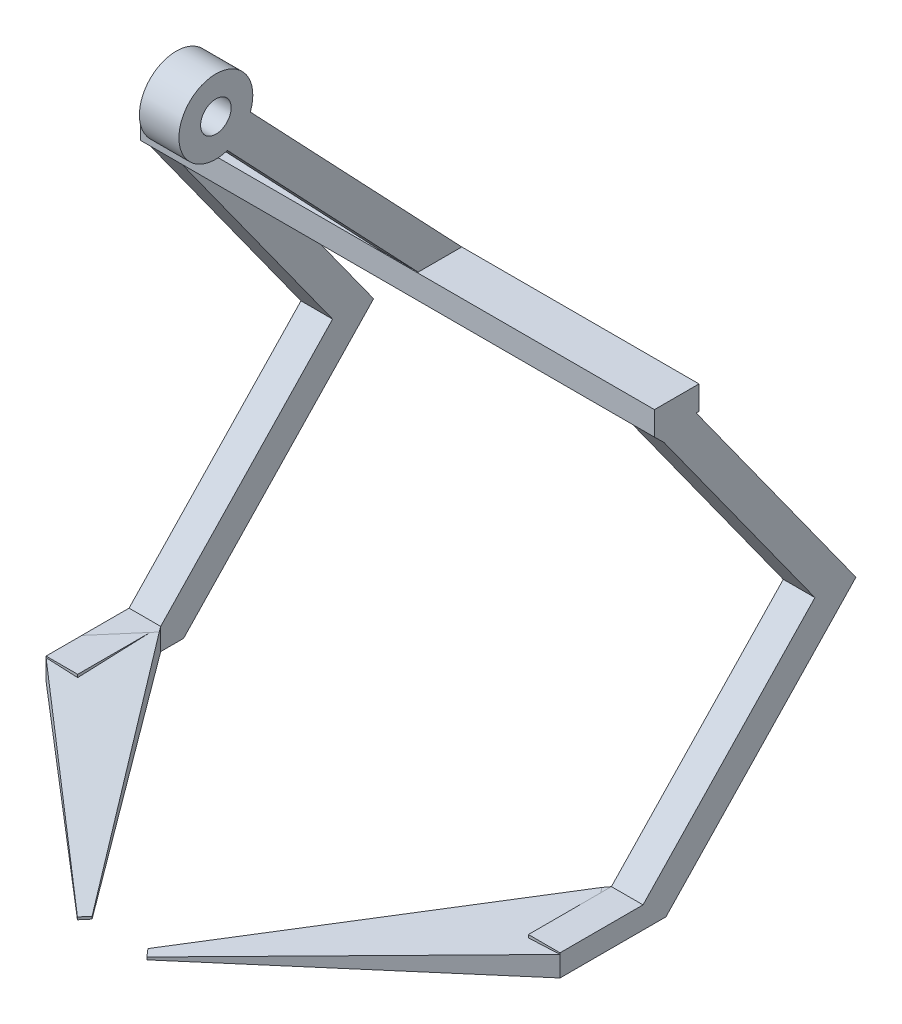
from build123d import *

# Parameters (mm, degrees)
SKETCH1_R                = 1.933011648
BOSS_EXTRUDE2_DEPTH      = 5
BOSS_EXTRUDE3_DEPTH      = 30
BOSS_EXTRUDE3_DEPTH_BACK = 35
SKETCH2_W                = 5.631130668
SKETCH2_H                = 3.014930961
BOSS_EXTRUDE4_DEPTH      = 4
LPATTERN1_COUNT          = 2
LPATTERN1_PITCH          = 61
BOSS_EXTRUDE7_START      = -2.761388983
BOSS_EXTRUDE7_DEPTH      = 2.761388983
CHAMFER4_SIZE            = 2.446504806
CHAMFER4_SIZE_2          = 40
CHAMFER5_SIZE            = 2.446504806
CHAMFER5_SIZE_2          = 40


# Read off the part's stored shape, not the designer's step: Boss-Extrude7
with BuildPart() as part:
    # Sketch1 → Boss-Extrude2 (new body)
    with BuildSketch(Plane(origin=(0, 0, 0), x_dir=(0, 0, -1), z_dir=(1, 0, 0))):
        with BuildLine():
            Line((-46.895851091, -15.500543616), (-20.154946043, -43.648864718))
            Line((-20.154946043, -43.648864718), (-17.254948309, -40.893866871))
            Line((-17.254948309, -40.893866871), (-43.995853357, -12.745545768))
            ThreePointArc((-43.995853357, -12.745545768), (-51.573956687, -7.672408414), (-46.895851091, -15.500543616))
        make_face()
        with Locations((-48.355084699, -11.060694718)):
            Circle(SKETCH1_R, mode=Mode.SUBTRACT)
    extrude(amount=BOSS_EXTRUDE2_DEPTH)

    # Sketch2 → Boss-Extrude3 (add, two sides: drawn at the far end of the back side and taken through both)
    with BuildSketch(Plane(origin=(5, 0, 0), x_dir=(0, 0, -1), z_dir=(1, 0, 0)).offset(-BOSS_EXTRUDE3_DEPTH_BACK)):
        with Locations((-20.070513643, -42.401332352)):
            Rectangle(SKETCH2_W, SKETCH2_H)
    extrude(amount=BOSS_EXTRUDE3_DEPTH + BOSS_EXTRUDE3_DEPTH_BACK)

    # Sketch3 → Boss-Extrude4 (add)
    with BuildSketch(Plane(origin=(35, 0, 0), x_dir=(0, 0, -1), z_dir=(1, 0, 0))):
        Polygon((-21.694078936, -45.076717239), (-2.592969181, -71.629832685), (-24.333035342, -94.41324153), (-34.828765043, -94.41324153), (-34.828765043, -97.174630514), (-21.439122613, -97.174630514), (2.592969181, -71.989197834), (-18.446948351, -42.740878425), (-22.886078977, -43.908797832), align=None)
    boss_extrude4 = extrude(amount=-BOSS_EXTRUDE4_DEPTH)

    # LPattern1: Boss-Extrude4 ×2
    with Locations(*[(-i * LPATTERN1_PITCH, 0, 0) for i in range(1, LPATTERN1_COUNT)]):
        add(boss_extrude4)


with BuildPart() as body_2:
    # Boss-Extrude7 outline → Boss-Extrude7 (new body)
    with BuildSketch(Plane(origin=(0, -94.41324153, 0), x_dir=(1, 0, 0), z_dir=(0, 1, 0)).offset(BOSS_EXTRUDE7_START)):
        Polygon((31, -34.828765043), (31, -24.333035342), (6.034622548, -57.97687078), (6.8885851, -58.971222561), (35, -34.828765043), align=None)
        Polygon((-26, -24.333035342), (-30, -24.333035342), (-30, -34.828765043), (-1.8885851, -58.971222561), (-1.034622548, -57.97687078), align=None)
    extrude(amount=BOSS_EXTRUDE7_DEPTH)

    # Chamfer4
    # the kernel refuses this chamfer: 40, 2.446504806 mm, written as the material it takes off along each edge
    with BuildSketch(Plane(origin=(-69.64215859, -94.41324153, 137.86330783), x_dir=(0.40332576937215514, -0.8469640789593069, 0.346381542107792), z_dir=(0.6515216112589131, 0, -0.7586300745835153))) as chamfer4_piece_1:
        Polygon((CHAMFER4_SIZE * 0.846964078966, CHAMFER4_SIZE * 0.531650118929), (-CHAMFER4_SIZE_2 * 0.531650118925, CHAMFER4_SIZE_2 * 0.846964078959), (0, 0), align=None)
    extrude(amount=209.296372024, mode=Mode.SUBTRACT)

    # Chamfer5
    # the kernel refuses this chamfer: 40, 2.446504806 mm, written as the material it takes off along each edge
    with BuildSketch(Plane(origin=(-61.718950942, -94.41324153, -20.915214489), x_dir=(-0.4033257693721534, -0.8469640789593084, 0.34638154210779065), z_dir=(0.6515216112589132, 0, 0.7586300745835151))) as chamfer5_piece_1:
        Polygon((CHAMFER5_SIZE * 0.846964078966, CHAMFER5_SIZE * 0.531650118929), (-CHAMFER5_SIZE_2 * 0.531650118925, CHAMFER5_SIZE_2 * 0.846964078959), (0, 0), align=None)
    extrude(amount=209.296372024, mode=Mode.SUBTRACT)


solid = Compound([part.part, body_2.part])
